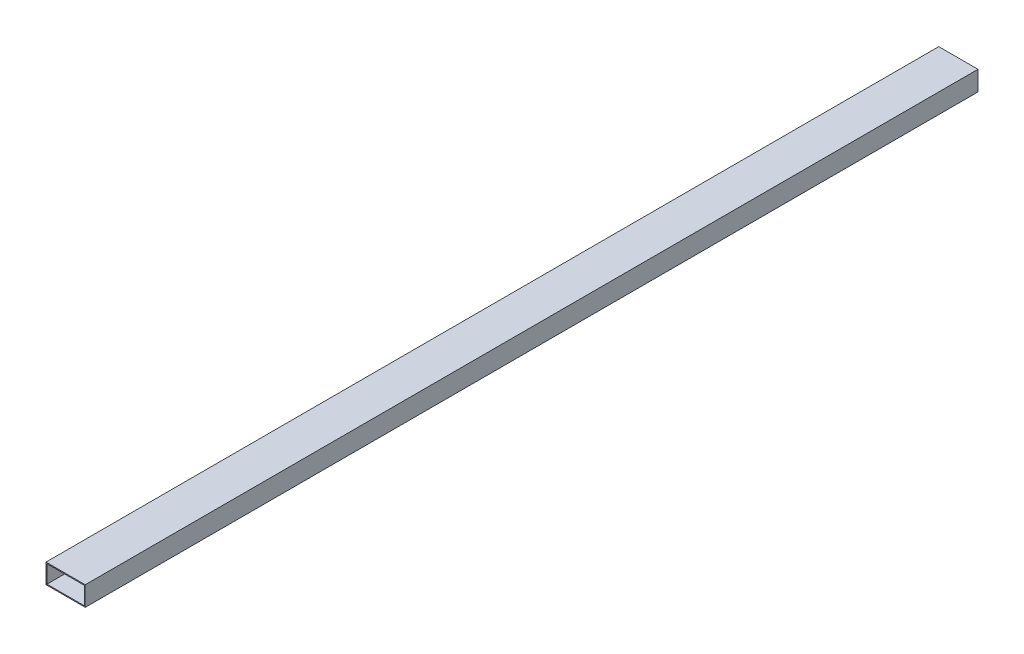
from build123d import *

# Parameters (mm, degrees)
SKETCH_1_W          = 40
SKETCH_1_H          = 20
SKETCH_1_W_2        = 38
SKETCH_1_H_2        = 18
EXTRUDE_1_DEPTH     = 910
CUT_EXTRUDE_1_REACH = 913.098
SKETCH_2_R          = 1.6


with BuildPart() as part:
    # 草图1 → 拉伸-薄壁1 (new body)
    with BuildSketch(Plane.XY):
        with Locations((-20, 10)):
            Rectangle(SKETCH_1_W, SKETCH_1_H)
        with Locations((-20, 10)):
            Rectangle(SKETCH_1_W_2, SKETCH_1_H_2, mode=Mode.SUBTRACT)
    extrude(amount=EXTRUDE_1_DEPTH)

    # 草图2 → 切除-拉伸1 (cut, up to next)
    with BuildSketch(Plane.ZY.offset(40), mode=Mode.PRIVATE) as cut_extrude_1_sk1:
        with Locations((865, 10)):
            Circle(SKETCH_2_R)
    cut_extrude_1_tool1 = extrude(cut_extrude_1_sk1.sketch, amount=-CUT_EXTRUDE_1_REACH, mode=Mode.PRIVATE) & part.part
    # 草图2 → 切除-拉伸1 (cut, up to next)
    with BuildSketch(Plane.ZY.offset(40), mode=Mode.PRIVATE) as cut_extrude_1_sk2:
        with Locations((845, 10)):
            Circle(SKETCH_2_R)
    cut_extrude_1_tool2 = extrude(cut_extrude_1_sk2.sketch, amount=-CUT_EXTRUDE_1_REACH, mode=Mode.PRIVATE) & part.part
    # 草图2 → 切除-拉伸1 (cut, up to next)
    with BuildSketch(Plane.ZY.offset(40), mode=Mode.PRIVATE) as cut_extrude_1_sk3:
        with Locations((825, 10)):
            Circle(SKETCH_2_R)
    cut_extrude_1_tool3 = extrude(cut_extrude_1_sk3.sketch, amount=-CUT_EXTRUDE_1_REACH, mode=Mode.PRIVATE) & part.part
    # 草图2 → 切除-拉伸1 (cut, up to next)
    with BuildSketch(Plane.ZY.offset(40), mode=Mode.PRIVATE) as cut_extrude_1_sk4:
        with Locations((45, 10)):
            Circle(SKETCH_2_R)
    cut_extrude_1_tool4 = extrude(cut_extrude_1_sk4.sketch, amount=-CUT_EXTRUDE_1_REACH, mode=Mode.PRIVATE) & part.part
    # 草图2 → 切除-拉伸1 (cut, up to next)
    with BuildSketch(Plane.ZY.offset(40), mode=Mode.PRIVATE) as cut_extrude_1_sk5:
        with Locations((25, 10)):
            Circle(SKETCH_2_R)
    cut_extrude_1_tool5 = extrude(cut_extrude_1_sk5.sketch, amount=-CUT_EXTRUDE_1_REACH, mode=Mode.PRIVATE) & part.part
    # 草图2 → 切除-拉伸1 (cut, up to next)
    with BuildSketch(Plane.ZY.offset(40), mode=Mode.PRIVATE) as cut_extrude_1_sk6:
        with Locations((5, 10)):
            Circle(SKETCH_2_R)
    cut_extrude_1_tool6 = extrude(cut_extrude_1_sk6.sketch, amount=-CUT_EXTRUDE_1_REACH, mode=Mode.PRIVATE) & part.part
    add(cut_extrude_1_tool1.solids().sort_by_distance((-40, 10, 865))[0], mode=Mode.SUBTRACT)
    add(cut_extrude_1_tool2.solids().sort_by_distance((-40, 10, 845))[0], mode=Mode.SUBTRACT)
    add(cut_extrude_1_tool3.solids().sort_by_distance((-40, 10, 825))[0], mode=Mode.SUBTRACT)
    add(cut_extrude_1_tool4.solids().sort_by_distance((-40, 10, 45))[0], mode=Mode.SUBTRACT)
    add(cut_extrude_1_tool5.solids().sort_by_distance((-40, 10, 25))[0], mode=Mode.SUBTRACT)
    add(cut_extrude_1_tool6.solids().sort_by_distance((-40, 10, 5))[0], mode=Mode.SUBTRACT)


solid = part.part
